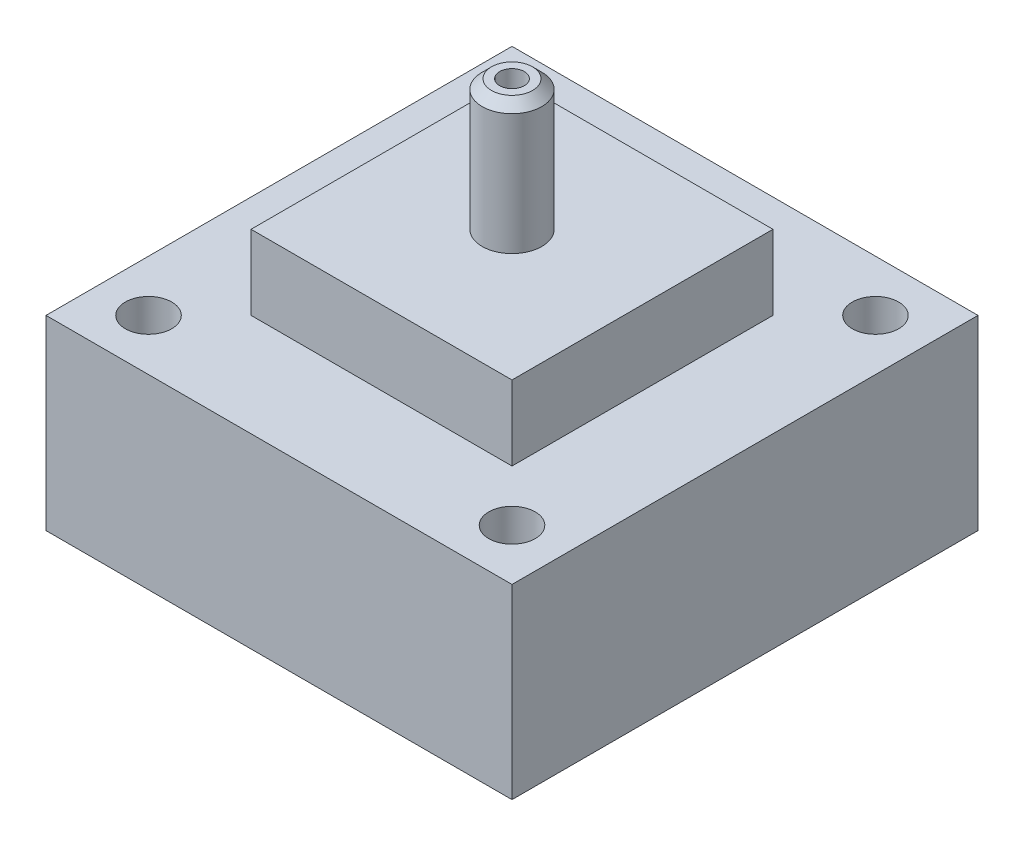
from build123d import *

# Parameters (mm, degrees)
SKETCH1_W           = 14
SKETCH1_H           = 14
BOSS_EXTRUDE1_DEPTH = 4
SKETCH2_W           = 25
SKETCH2_H           = 25
SKETCH2_R           = 1.2446
BOSS_EXTRUDE2_DEPTH = 10
SKETCH3_R           = 4.23
CUT_EXTRUDE1_DEPTH  = 9.8
CUT_EXTRUDE2_START  = -14
SKETCH5_R           = 0.6604
CUT_EXTRUDE2_DEPTH  = 14


with BuildPart() as part:
    # Sketch1 → Boss-Extrude1 (new body)
    with BuildSketch(Plane(origin=(0, 0, 0), x_dir=(1, 0, 0), z_dir=(0, 1, 0))):
        Rectangle(SKETCH1_W, SKETCH1_H)
    extrude(amount=BOSS_EXTRUDE1_DEPTH)

    # Sketch2 → Boss-Extrude2 (add)
    with BuildSketch(Plane.XZ):
        Rectangle(SKETCH2_W, SKETCH2_H)
        with Locations(Location((-9.75, 9.75, 0), (0, 0, 270))):
            Circle(SKETCH2_R, mode=Mode.SUBTRACT)
        with Locations(Location((9.75, 9.75, 0), (0, 0, 270))):
            Circle(SKETCH2_R, mode=Mode.SUBTRACT)
        with Locations(Location((9.75, -9.75, 0), (0, 0, 270))):
            Circle(SKETCH2_R, mode=Mode.SUBTRACT)
        with Locations(Location((-9.75, -9.75, 0), (0, 0, 270))):
            Circle(SKETCH2_R, mode=Mode.SUBTRACT)
    extrude(amount=BOSS_EXTRUDE2_DEPTH)

    # Sketch3 → Cut-Extrude1 (cut)
    with BuildSketch(Plane.XZ.offset(10)):
        with Locations(Location((0, 0, 0), (0, 0, 270))):
            Circle(SKETCH3_R)
    extrude(amount=-CUT_EXTRUDE1_DEPTH, mode=Mode.SUBTRACT)

    # Sketch4 → Revolve1 (revolve)
    with BuildSketch(Plane(origin=(0, 0, 0), x_dir=(0, 0, -1), z_dir=(1, 0, 0))):
        Polygon((0.6604, 11), (0.6604, 4), (1.6, 4), (1.6, 10.5), (1.1, 11), align=None)
    revolve(axis=Axis((0, 4, 0), (0, 1, 0)))

    # Sketch5 → Cut-Extrude2 (cut)
    with BuildSketch(Plane(origin=(0, 4, 0), x_dir=(1, 0, 0), z_dir=(0, 1, 0)).offset(CUT_EXTRUDE2_START)):
        with Locations(Location((0, 0, 0), (0, 0, 90))):
            Circle(SKETCH5_R)
    extrude(amount=CUT_EXTRUDE2_DEPTH, mode=Mode.SUBTRACT)


solid = part.part
